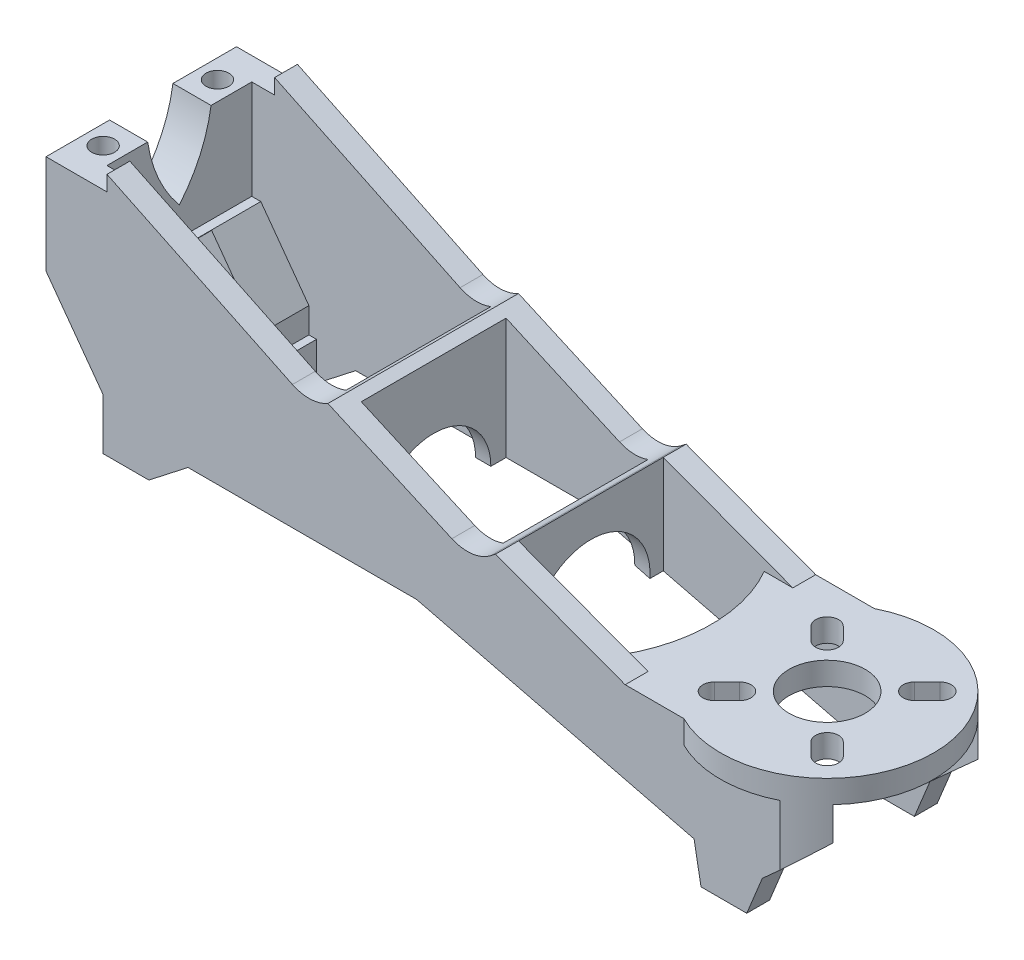
from build123d import *

# Parameters (mm, degrees)
EXTRUDE_1_DEPTH     = 3
SKETCH_2_W          = 25
SKETCH_2_H          = 13
EXTRUDE_2_DEPTH     = 5
EXTRUDE_3_DEPTH     = 3
EXTRUDE_4_REACH     = 106.361
CUT_EXTRUDE_1_DEPTH = 105.987345913
SKETCH_6_W          = 6.056667596
SKETCH_6_H          = 33.940287548
CUT_EXTRUDE_2_DEPTH = 98.013364038
EXTRUDE_5_REACH     = 106.361
CUT_EXTRUDE_3_DEPTH = 3
CUT_EXTRUDE_4_DEPTH = 3
EXTRUDE_6_DEPTH     = 3
CUT_EXTRUDE_5_DEPTH = 105.633226751
SKETCH_12_R         = 5
CUT_EXTRUDE_6_DEPTH = 5
SKETCH_13_R         = 1.5
CUT_EXTRUDE_7_DEPTH = 5
SKETCH_14_R         = 1.5
CUT_EXTRUDE_8_DEPTH = 5
FILLET_1_DEPTH      = 3
FILLET_START        = 22
FILLET_1_2_DEPTH    = 3
FILLET_START_2      = 2.3595
FILLET_1_3_DEPTH    = 20


with BuildPart() as part:
    # 草图1 → 凸台-拉伸1 (new body)
    with BuildSketch(Plane.XY):
        Polygon((-98.335457187, 15.579868922), (-90.335457187, 15.579868922), (-90.335457187, 17.579868922), (-63.335457187, 4.579868922), (-61.335457187, 6.036256747), (-42.335457187, -2.420131078), (-39.335457187, -0.081665222), (-22.335457187, -6.420131078), (-10.835457187, -6.420131078), (5.664542813, -6.420131078), (5.664542813, -10.420131078), (-4.335457187, -19.420131078), (-6.381981311, -24.420131078), (-12.381981311, -24.420131078), (-13.29747583, -19.420131078), (-49.703887716, -10.420131078), (-79.703887716, -10.420131078), (-84.835457187, -14.420131078), (-90.835457187, -14.420131078), (-90.835457187, -7.719585483), (-98.335457187, 2.579868922), align=None)
    extrude(amount=EXTRUDE_1_DEPTH)

    # 草图2 → 凸台-拉伸2 (add)
    with BuildSketch(Plane.ZY.offset(98.335457187)):
        with Locations((12.5, 9.079868922)):
            Rectangle(SKETCH_2_W, SKETCH_2_H)
    extrude(amount=-EXTRUDE_2_DEPTH)

    # 草图3 → 凸台-拉伸3 (add)
    with BuildSketch(Plane.XY.offset(25)):
        Polygon((-90.335457187, 15.579868922), (-98.335457187, 15.579868922), (-98.335457187, 2.579868922), (-90.835457187, -7.719585483), (-90.835457187, -14.420131078), (-84.835457187, -14.420131078), (-79.703887716, -10.420131078), (-49.703887716, -10.420131078), (-13.29747583, -19.420131078), (-12.381981311, -24.420131078), (-6.381981311, -24.420131078), (-4.335457187, -19.420131078), (5.664542813, -10.420131078), (5.664542813, -6.420131078), (-22.335457187, -6.420131078), (-39.335457187, -0.081665222), (-42.335457187, -2.420131078), (-61.335457187, 6.036256747), (-63.335457187, 4.579868922), (-90.335457187, 17.579868922), align=None)
    extrude(amount=-EXTRUDE_3_DEPTH)

    # 草图4 → 凸台-拉伸4 (add, up to next)
    with BuildSketch(Plane.XY.offset(25), mode=Mode.PRIVATE) as extrude_4_sk1:
        Polygon((-98.335457187, 2.579868922), (-90.835457187, -7.719585483), (-90.835457187, -14.420131078), (-84.835457187, -14.420131078), (-84.835457187, -9.420131078), (-85.835457187, -9.420131078), (-85.835457187, -6.09200144), (-92.150260395, 2.579868922), align=None)
    extrude_4_tool1 = extrude(extrude_4_sk1.sketch, amount=-EXTRUDE_4_REACH, mode=Mode.PRIVATE) - part.part
    add(extrude_4_tool1.solids().sort_by_distance((-90.201592, -5.80053, 25))[0])

    # 草图5 → 切除-拉伸1 (cut, through all)
    with BuildSketch(Plane(origin=(-93.335457187, 0, 0), x_dir=(0, 0, -1), z_dir=(1, 0, 0))):
        with BuildLine():
            Line((-16.657130076, 15.579868922), (-8.342869924, 15.579868922))
            ThreePointArc((-8.342869924, 15.579868922), (-9.779019247, 10.678144674), (-12.5, 6.355450003))
            ThreePointArc((-12.5, 6.355450003), (-15.220980753, 10.678144674), (-16.657130076, 15.579868922))
        make_face()
    extrude(amount=-CUT_EXTRUDE_1_DEPTH, mode=Mode.SUBTRACT)

    # 草图6 → 切除-拉伸2 (cut, through all)
    with BuildSketch(Plane(origin=(-84.835457187, 0, 0), x_dir=(0, 0, -1), z_dir=(1, 0, 0))):
        with Locations((-12.5, -14.420131078)):
            Rectangle(SKETCH_6_W, SKETCH_6_H)
    extrude(amount=-CUT_EXTRUDE_2_DEPTH, mode=Mode.SUBTRACT)

    # 草图7 → 凸台-拉伸5 (add, up to next)
    with BuildSketch(Plane(origin=(0, 0, 0), x_dir=(-1, 0, 0), z_dir=(0, 0, -1)), mode=Mode.PRIVATE) as extrude_5_sk1:
        Polygon((41.335457187, -1.64064246), (39.335457187, -0.081665222), (39.335457187, -12.983302507), (41.335457187, -12.488884104), align=None)
    extrude_5_tool1 = extrude(extrude_5_sk1.sketch, amount=-EXTRUDE_5_REACH, mode=Mode.PRIVATE) - part.part
    # 草图7 → 凸台-拉伸5 (add, up to next)
    with BuildSketch(Plane(origin=(0, 0, 0), x_dir=(-1, 0, 0), z_dir=(0, 0, -1)), mode=Mode.PRIVATE) as extrude_5_sk2:
        Polygon((59.961995831, 5.424966121), (59.961995831, -10.420131078), (61.961995831, -10.420131078), (61.961995831, 5.580015121), (61.335457187, 6.036256747), align=None)
    extrude_5_tool2 = extrude(extrude_5_sk2.sketch, amount=-EXTRUDE_5_REACH, mode=Mode.PRIVATE) - part.part
    add(extrude_5_tool1.solids().sort_by_distance((-40.306637, -6.790953, 0))[0])
    add(extrude_5_tool2.solids().sort_by_distance((-60.965536, -2.331748, 0))[0])

    # 草图8 → 切除-拉伸3 (cut)
    with BuildSketch(Plane(origin=(-39.335457187, 0, 0), x_dir=(0, 0, -1), z_dir=(1, 0, 0))):
        with BuildLine():
            Line((-20.2471791, -12.983302507), (-4.7528209, -12.983302507))
            ThreePointArc((-4.7528209, -12.983302507), (-12.5, -4.669641244), (-20.2471791, -12.983302507))
        make_face()
    extrude(amount=-CUT_EXTRUDE_3_DEPTH, mode=Mode.SUBTRACT)

    # 草图9 → 切除-拉伸4 (cut)
    with BuildSketch(Plane(origin=(-59.961995831, 0, 0), x_dir=(0, 0, -1), z_dir=(1, 0, 0))):
        with BuildLine():
            Line((-20.000265411, -10.420131078), (-4.999734589, -10.420131078))
            ThreePointArc((-4.999734589, -10.420131078), (-12.5, -2.919865667), (-20.000265411, -10.420131078))
        make_face()
    extrude(amount=-CUT_EXTRUDE_4_DEPTH, mode=Mode.SUBTRACT)

    # 草图10 → 凸台-拉伸6 (add)
    with BuildSketch(Plane(origin=(0, -6.420131078, 0), x_dir=(1, 0, 0), z_dir=(0, 1, 0))):
        with BuildLine():
            Line((-26.085728059, -3), (-26.085728059, 0))
            Line((-26.085728059, 0), (-14.640217294, 0))
            ThreePointArc((-14.640217294, 0), (5.664542813, -12.5), (-14.640217294, -25))
            Line((-14.640217294, -25), (-26.085728059, -25))
            Line((-26.085728059, -25), (-26.085728059, -22))
            ThreePointArc((-26.085728059, -22), (-23.536750664, -12.5), (-26.085728059, -3))
        make_face()
    extrude(amount=-EXTRUDE_6_DEPTH)

    # 草图11 → 切除-拉伸5 (cut, through all)
    with BuildSketch(Plane(origin=(0, -6.420131078, 0), x_dir=(1, 0, 0), z_dir=(0, 1, 0))):
        with BuildLine():
            Line((-2.030697081, 0), (16.123773985, 18.747228403))
            Line((16.123773985, 18.747228403), (16.123773985, -39.39165183))
            Line((16.123773985, -39.39165183), (-2.030697081, -25))
            ThreePointArc((-2.030697081, -25), (5.664542813, -12.5), (-2.030697081, 0))
        make_face()
    extrude(amount=-CUT_EXTRUDE_5_DEPTH, mode=Mode.SUBTRACT)

    # 草图12 → 切除-拉伸6 (cut)
    with BuildSketch(Plane(origin=(0, -6.420131078, 0), x_dir=(1, 0, 0), z_dir=(0, 1, 0))):
        with Locations(Location((-8.335457187, -12.5, 0), (0, 0, 180))):
            Circle(SKETCH_12_R)
        with BuildLine():
            Line((-1.527591385, -17.186545459), (0.125093583, -18.839230427))
            ThreePointArc((0.125093583, -18.839230427), (0.125093583, -20.960550771), (-1.99622676, -20.960550771))
            Line((-1.99622676, -20.960550771), (-3.648911729, -19.307865802))
            ThreePointArc((-3.648911729, -19.307865802), (-3.648911729, -17.186545459), (-1.527591385, -17.186545459))
        make_face()
        with BuildLine():
            Line((-13.022002646, -19.307865802), (-14.674687614, -20.960550771))
            ThreePointArc((-14.674687614, -20.960550771), (-16.796007958, -20.960550771), (-16.796007958, -18.839230427))
            Line((-16.796007958, -18.839230427), (-15.143322989, -17.186545459))
            ThreePointArc((-15.143322989, -17.186545459), (-13.022002646, -17.186545459), (-13.022002646, -19.307865802))
        make_face()
        with BuildLine():
            Line((-15.143322989, -7.813454541), (-16.796007958, -6.160769573))
            ThreePointArc((-16.796007958, -6.160769573), (-16.796007958, -4.039449229), (-14.674687614, -4.039449229))
            Line((-14.674687614, -4.039449229), (-13.022002646, -5.692134198))
            ThreePointArc((-13.022002646, -5.692134198), (-13.022002646, -7.813454541), (-15.143322989, -7.813454541))
        make_face()
        with BuildLine():
            Line((-3.648911729, -5.692134198), (-1.99622676, -4.039449229))
            ThreePointArc((-1.99622676, -4.039449229), (0.125093583, -4.039449229), (0.125093583, -6.160769573))
            Line((0.125093583, -6.160769573), (-1.527591385, -7.813454541))
            ThreePointArc((-1.527591385, -7.813454541), (-3.648911729, -7.813454541), (-3.648911729, -5.692134198))
        make_face()
    extrude(amount=-CUT_EXTRUDE_6_DEPTH, mode=Mode.SUBTRACT)

    # 草图13 → 切除-拉伸7 (cut)
    with BuildSketch(Plane(origin=(0, 15.579868922, 0), x_dir=(1, 0, 0), z_dir=(0, 1, 0))):
        with Locations(Location((-95.835457187, -5, 0), (0, 0, 270))):
            Circle(SKETCH_13_R)
        with Locations(Location((-95.835457187, -20, 0), (0, 0, 270))):
            Circle(SKETCH_13_R)
    extrude(amount=-CUT_EXTRUDE_7_DEPTH, mode=Mode.SUBTRACT)

    # 草图14 → 切除-拉伸8 (cut)
    with BuildSketch(Plane.XZ.offset(14.420131078)):
        with Locations(Location((-88.335457187, 20, 0), (0, 0, 270))):
            Circle(SKETCH_14_R)
        with Locations(Location((-88.335457187, 5, 0), (0, 0, 270))):
            Circle(SKETCH_14_R)
    extrude(amount=-CUT_EXTRUDE_8_DEPTH, mode=Mode.SUBTRACT)

    # 圆角1: read off the stored shape, not the designer's step
    # 圆角1 outline → 圆角1 (add)
    with BuildSketch(Plane.XY):
        with BuildLine():
            ThreePointArc((-39.969314292, -0.575749621), (-42.436321647, -1.595291169), (-45.076309168, -1.200251746))
            Line((-45.076309168, -1.200251746), (-42.335457187, -2.420131078))
            Line((-42.335457187, -2.420131078), (-39.969314292, -0.575749621))
        make_face()
        with BuildLine():
            ThreePointArc((-61.335457187, 6.036256747), (-63.646870744, 5.371779089), (-66.001128729, 5.863340405))
            Line((-66.001128729, 5.863340405), (-63.335457187, 4.579868922))
            Line((-63.335457187, 4.579868922), (-61.335457187, 6.036256747))
        make_face()
    extrude(amount=FILLET_1_DEPTH)

    # Fillet 1 2 outline → Fillet 1 2 (add)
    with BuildSketch(Plane.XY.offset(FILLET_START)):
        with BuildLine():
            ThreePointArc((-39.969314292, -0.575749621), (-42.436321647, -1.595291169), (-45.076309168, -1.200251746))
            Line((-45.076309168, -1.200251746), (-42.335457187, -2.420131078))
            Line((-42.335457187, -2.420131078), (-39.969314292, -0.575749621))
        make_face()
        with BuildLine():
            ThreePointArc((-61.335457187, 6.036256747), (-63.646870744, 5.371779089), (-66.001128729, 5.863340405))
            Line((-66.001128729, 5.863340405), (-63.335457187, 4.579868922))
            Line((-63.335457187, 4.579868922), (-61.335457187, 6.036256747))
        make_face()
    extrude(amount=FILLET_1_2_DEPTH)

    # Fillet 1 3 outline → Fillet 1 3 (add)
    with BuildSketch(Plane.XY.offset(FILLET_START_2)):
        with BuildLine():
            Line((-41.335457187, -1.64064246), (-39.969314292, -0.575749621))
            ThreePointArc((-39.969314292, -0.575749621), (-40.622702266, -1.007314283), (-41.335457187, -1.331573939))
            Line((-41.335457187, -1.331573939), (-41.335457187, -1.64064246))
        make_face()
        with BuildLine():
            Line((-61.961995831, 5.580015121), (-61.335457187, 6.036256747))
            ThreePointArc((-61.335457187, 6.036256747), (-61.643406083, 5.872813744), (-61.961995831, 5.731227337))
            Line((-61.961995831, 5.731227337), (-61.961995831, 5.580015121))
        make_face()
    extrude(amount=FILLET_1_3_DEPTH)


solid = part.part
